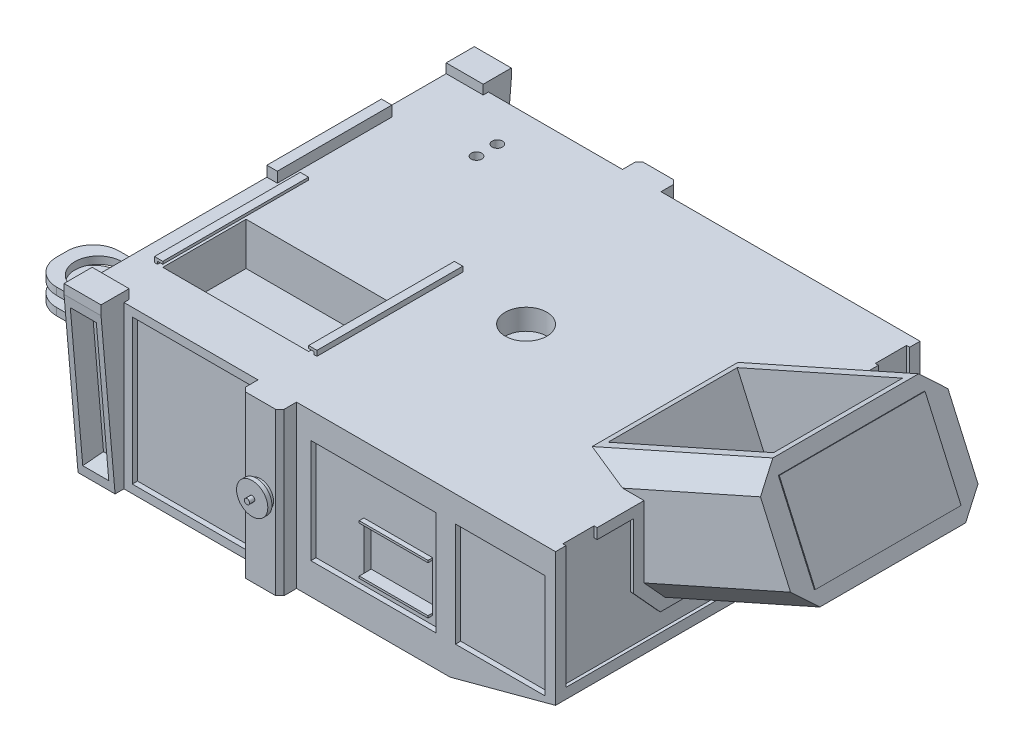
from build123d import *

# Parameters (mm, degrees)
SKETCH1_W                = 450
SKETCH1_H                = 155
BOSS_EXTRUDE1_DEPTH      = 175
BOSS_EXTRUDE2_START      = -5
SKETCH2_W                = 35.55
SKETCH2_H                = 164
BOSS_EXTRUDE2_DEPTH      = 27
SKETCH2_3_W              = 37
SKETCH2_3_H              = 155
BOSS_EXTRUDE3_DEPTH      = 16
CUT_EXTRUDE1_DEPTH       = 425.979117134
CUT_EXTRUDE1_DEPTH_BACK  = 425.979117134
CUT_EXTRUDE3_REACH       = 500.79
CHAMFER1_SIZE            = 4
SKETCH6_W                = 35.55
SKETCH6_H                = 155
BOSS_EXTRUDE4_DEPTH      = 16
SKETCH8_R                = 12.5
BOSS_EXTRUDE5_DEPTH      = 4
SKETCH9_R                = 15
BOSS_EXTRUDE6_DEPTH      = 4
SKETCH10_R               = 2.5
BOSS_EXTRUDE7_DEPTH      = 5
SKETCH11_W               = 120
SKETCH11_H               = 100
SKETCH11_W_2             = 86
SKETCH11_W_3             = 112.725
SKETCH11_H_2             = 139
CUT_EXTRUDE4_DEPTH       = 5
SKETCH12_W               = 66
SKETCH12_H               = 44
CUT_EXTRUDE5_DEPTH       = 7
SKETCH13_W               = 66
SKETCH13_H               = 2
BOSS_EXTRUDE8_DEPTH      = 4.5
SKETCH14_W               = 25
SKETCH14_H               = 138
CUT_EXTRUDE6_DEPTH       = 20
CHAMFER1_OF_MIRROR1_SIZE = 4
SKETCH15_W               = 105
SKETCH15_H               = 120
CUT_EXTRUDE7_DEPTH       = 15
SKETCH16_R               = 7.5
BOSS_EXTRUDE9_DEPTH      = 15
SKETCH17_R               = 48.5
BOSS_EXTRUDE10_DEPTH     = 10
SKETCH18_R               = 35
BOSS_EXTRUDE11_DEPTH     = 5
SKETCH19_W               = 60
SKETCH19_H               = 7
BOSS_EXTRUDE12_DEPTH     = 85
FILLET1_R                = 25
SKETCH20_R               = 22.5
CUT_EXTRUDE8_DEPTH       = 395.019352317
SKETCH21_W               = 10
SKETCH21_H               = 110
BOSS_EXTRUDE13_DEPTH     = 10
SKETCH22_W               = 90
SKETCH22_H               = 5
CUT_EXTRUDE9_DEPTH       = 2
SKETCH23_W               = 95
SKETCH23_H               = 32
CUT_EXTRUDE10_DEPTH      = 5
SKETCH24_R               = 20
CUT_EXTRUDE11_DEPTH      = 20
BOSS_EXTRUDE14_DEPTH     = 90
CHAMFER2_SIZE            = 20
SHELL3_START             = -220
SHELL3_DEPTH             = 25.55
SKETCH27_W               = 173.909634345
SKETCH27_H               = 124
CUT_EXTRUDE12_DEPTH      = 111
SKETCH32_W               = 140
SKETCH32_H               = 85
BOSS_EXTRUDE17_DEPTH     = 1
CUT_EXTRUDE15_DEPTH      = 3
SKETCH39_R               = 35
BOSS_EXTRUDE21_DEPTH     = 10
SKETCH41_R               = 5
CUT_EXTRUDE16_DEPTH      = 2
BOSS_EXTRUDE25_DEPTH     = 21
SKETCH58_R               = 11
SKETCH58_R_2             = 7.5
BOSS_EXTRUDE34_DEPTH     = 2
LPATTERN1_COUNT          = 4
LPATTERN1_PITCH          = 25
SKETCH59_R               = 35
BOSS_EXTRUDE35_DEPTH     = 3
SKETCH61_R               = 30
BOSS_EXTRUDE36_DEPTH     = 4
BOSS_EXTRUDE37_DEPTH     = 15
BOSS_EXTRUDE37_2_DEPTH   = 15
CUT_EXTRUDE19_START      = 64.5
CUT_EXTRUDE19_OUTLINE_R  = 11.5
CUT_EXTRUDE19_DEPTH      = 20
CHAMFER6_SIZE            = 10
CHAMFER7_SIZE            = 10
SKETCH63_R               = 4
CUT_EXTRUDE20_DEPTH      = 2
SKETCH64_R               = 4
CUT_EXTRUDE21_DEPTH      = 2
SKETCH65_R               = 40
BOSS_EXTRUDE38_DEPTH     = 4
SKETCH66_R               = 37.5
BOSS_EXTRUDE39_DEPTH     = 3
SKETCH67_R               = 25
CUT_EXTRUDE22_DEPTH      = 15
SKETCH68_W               = 20
SKETCH68_H               = 20
BOSS_EXTRUDE40_DEPTH     = 15
SKETCH69_R               = 5
CUT_EXTRUDE23_DEPTH      = 10
CUT_EXTRUDE25_DEPTH      = 68
SKETCH71_R               = 5
CUT_EXTRUDE26_DEPTH      = 7
SKETCH72_W               = 140.04861587
SKETCH72_H               = 79.982086861
CUT_EXTRUDE27_DEPTH      = 41
SKETCH73_R               = 11.5
BOSS_EXTRUDE42_DEPTH     = 13
SKETCH74_W               = 3
SKETCH74_H               = 140
BOSS_EXTRUDE43_DEPTH     = 5
SKETCH75_W               = 140
SKETCH75_H               = 2.5
BOSS_EXTRUDE44_DEPTH     = 5
SKETCH76_W               = 140
SKETCH76_H               = 2.5
BOSS_EXTRUDE45_DEPTH     = 5


# Read off the part's stored shape, not the designer's step: Shell3, Cut-Extrude19
with BuildPart() as part:
    # Sketch1 → Boss-Extrude1 (new, symmetric)
    with BuildSketch(Plane.XY):
        Rectangle(SKETCH1_W, SKETCH1_H)
    extrude(amount=BOSS_EXTRUDE1_DEPTH, both=True)

    # Sketch2 → Boss-Extrude2 (add)
    with BuildSketch(Plane.XY.offset(175).offset(BOSS_EXTRUDE2_START)):
        with Locations((-207.225, 4.5)):
            Rectangle(SKETCH2_W, SKETCH2_H)
    boss_extrude2 = extrude(amount=BOSS_EXTRUDE2_DEPTH)

    # Sketch2<3> → Boss-Extrude3 (add)
    with BuildSketch(Plane.XY.offset(175)):
        with Locations((-42.225, 0)):
            Rectangle(SKETCH2_3_W, SKETCH2_3_H)
    boss_extrude3 = extrude(amount=BOSS_EXTRUDE3_DEPTH)

    # Sketch2<4> → Cut-Extrude1 (cut, two sides: drawn at the far end of the back side and taken through both)
    with BuildSketch(Plane.XY.offset(175).offset(-CUT_EXTRUDE1_DEPTH_BACK)):
        Polygon((123.658328291, -77.5), (225, -50.345580906), (225, -77.5), align=None)
    extrude(amount=CUT_EXTRUDE1_DEPTH + CUT_EXTRUDE1_DEPTH_BACK, mode=Mode.SUBTRACT)

    # Sketch4 → Cut-Extrude3 (cut, up to next)
    with BuildSketch(Plane.ZY.offset(225), mode=Mode.PRIVATE) as cut_extrude3_sk1:
        Polygon((197, 77.5), (197, -77.5), (183.5, -77.5), align=None)
    cut_extrude3_tool1 = extrude(cut_extrude3_sk1.sketch, amount=-CUT_EXTRUDE3_REACH, mode=Mode.PRIVATE) & part.part
    cut_extrude3 = cut_extrude3_tool1.solids().sort_by_distance((-225, -25.833333, 192.5))[0]
    add(cut_extrude3, mode=Mode.SUBTRACT)

    # Chamfer1
    chamfer1_edges = [part.edges().sort_by_distance(p)[0] for p in [
        (-23.725, 0, 191),
        (-60.725, 0, 191),
    ]]
    chamfer(chamfer1_edges, length=CHAMFER1_SIZE)

    # Sketch6 → Boss-Extrude4 (add)
    with BuildSketch(Plane.XY.offset(175)):
        with Locations((-207.225, 0)):
            Rectangle(SKETCH6_W, SKETCH6_H)
    extrude(amount=-BOSS_EXTRUDE4_DEPTH)

    # Sketch8 → Boss-Extrude5 (add)
    with BuildSketch(Plane.XY.offset(191)):
        with Locations(Location((-42.314976126, 0, 0), (0, 0, 180))):
            Circle(SKETCH8_R)
    boss_extrude5 = extrude(amount=BOSS_EXTRUDE5_DEPTH)

    # Sketch9 → Boss-Extrude6 (add)
    with BuildSketch(Plane.XY.offset(195)):
        with Locations((-42.314976126, 0)):
            Circle(SKETCH9_R)
    boss_extrude6 = extrude(amount=BOSS_EXTRUDE6_DEPTH)

    # Sketch10 → Boss-Extrude7 (add)
    with BuildSketch(Plane.XY.offset(199)):
        with Locations((-42.314976126, 0)):
            Circle(SKETCH10_R)
    boss_extrude7 = extrude(amount=BOSS_EXTRUDE7_DEPTH)

    # Sketch11 → Cut-Extrude4 (cut)
    with BuildSketch(Plane.XY.offset(175)):
        with Locations((50, 2.5)):
            Rectangle(SKETCH11_W, SKETCH11_H)
        with Locations((171.861480719, 2.5)):
            Rectangle(SKETCH11_W_2, SKETCH11_H)
        with Locations((-125.0875, 0)):
            Rectangle(SKETCH11_W_3, SKETCH11_H_2)
    cut_extrude4 = extrude(amount=-CUT_EXTRUDE4_DEPTH, mode=Mode.SUBTRACT)

    # Sketch12 → Cut-Extrude5 (cut)
    with BuildSketch(Plane.XY.offset(170)):
        with Locations((69, -15.5)):
            Rectangle(SKETCH12_W, SKETCH12_H)
    cut_extrude5 = extrude(amount=-CUT_EXTRUDE5_DEPTH, mode=Mode.SUBTRACT)

    # Sketch13 → Boss-Extrude8 (add)
    with BuildSketch(Plane.XY.offset(170)):
        with Locations((69, 7.5)):
            Rectangle(SKETCH13_W, SKETCH13_H)
        with Locations((69, -38.5)):
            Rectangle(SKETCH13_W, SKETCH13_H)
    boss_extrude8 = extrude(amount=BOSS_EXTRUDE8_DEPTH)

    # Sketch14 → Cut-Extrude6 (cut)
    with BuildSketch(Plane(origin=(0, -16.445408917, 188.817657933), x_dir=(1, 0, 0), z_dir=(0, -0.08676829043906238, 0.9962285198559027))):
        with Locations((-207.225, 16.507667256)):
            Rectangle(SKETCH14_W, SKETCH14_H)
    cut_extrude6 = extrude(amount=-CUT_EXTRUDE6_DEPTH, mode=Mode.SUBTRACT)

    # Mirror1: Boss-Extrude2, Boss-Extrude3, Cut-Extrude3, Boss-Extrude5, Boss-Extrude6, Boss-Extrude7, Cut-Extrude4, Cut-Extrude5, Boss-Extrude8, Cut-Extrude6 across plane
    add(boss_extrude2.mirror(Plane.XY))
    add(boss_extrude3.mirror(Plane.XY))
    add(cut_extrude3.mirror(Plane.XY), mode=Mode.SUBTRACT)
    add(boss_extrude5.mirror(Plane.XY))
    add(boss_extrude6.mirror(Plane.XY))
    add(boss_extrude7.mirror(Plane.XY))
    add(cut_extrude4.mirror(Plane.XY), mode=Mode.SUBTRACT)
    add(cut_extrude5.mirror(Plane.XY), mode=Mode.SUBTRACT)
    add(boss_extrude8.mirror(Plane.XY))
    add(cut_extrude6.mirror(Plane.XY), mode=Mode.SUBTRACT)

    # Chamfer1 of Mirror1
    chamfer1_of_mirror1_edges = [part.edges().sort_by_distance(p)[0] for p in [
        (-23.725, 0, -191),
        (-60.725, 0, -191),
    ]]
    chamfer(chamfer1_of_mirror1_edges, length=CHAMFER1_OF_MIRROR1_SIZE)

    # Sketch15 → Cut-Extrude7 (cut)
    with BuildSketch(Plane.ZY.offset(225)):
        with Locations((-116.586660436, 0)):
            Rectangle(SKETCH15_W, SKETCH15_H)
    extrude(amount=-CUT_EXTRUDE7_DEPTH, mode=Mode.SUBTRACT)

    # Sketch16 → Boss-Extrude9 (add)
    with BuildSketch(Plane.ZY.offset(210)):
        with Locations((-142.086660436, -5)):
            Circle(SKETCH16_R)
    extrude(amount=BOSS_EXTRUDE9_DEPTH)

    # Sketch17 → Boss-Extrude10 (add)
    with BuildSketch(Plane.ZY.offset(225)):
        with Locations(Location((99, 0, 0), (0, 0, 90))):
            Circle(SKETCH17_R)
    extrude(amount=BOSS_EXTRUDE10_DEPTH)

    # Sketch18 → Boss-Extrude11 (add)
    with BuildSketch(Plane.ZY.offset(235)):
        with Locations(Location((99, 0, 0), (0, 0, 270))):
            Circle(SKETCH18_R)
    extrude(amount=BOSS_EXTRUDE11_DEPTH)

    # Sketch19 → Boss-Extrude12 (add)
    with BuildSketch(Plane.ZY.offset(240)):
        with Locations((99, 8.5)):
            Rectangle(SKETCH19_W, SKETCH19_H)
        with Locations((99, -8.5)):
            Rectangle(SKETCH19_W, SKETCH19_H)
    extrude(amount=BOSS_EXTRUDE12_DEPTH)

    # Fillet1
    fillet1_edges = [part.edges().sort_by_distance(p)[0] for p in [
        (-325, 8.5, 129),
        (-325, 8.5, 69),
        (-325, -8.5, 69),
        (-325, -8.5, 129),
    ]]
    fillet(fillet1_edges, radius=FILLET1_R)

    # Sketch20 → Cut-Extrude8 (cut, through all)
    with BuildSketch(Plane(origin=(0, 12, 0), x_dir=(1, 0, 0), z_dir=(0, 1, 0))):
        with Locations(Location((-290, -99, 0), (0, 0, 180))):
            Circle(SKETCH20_R)
    extrude(amount=-CUT_EXTRUDE8_DEPTH, mode=Mode.SUBTRACT)

    # Sketch21 → Boss-Extrude13 (add)
    with BuildSketch(Plane(origin=(0, 77.5, 0), x_dir=(1, 0, 0), z_dir=(0, 1, 0))):
        with Locations((-220, 52.801598025)):
            Rectangle(SKETCH21_W, SKETCH21_H)
    extrude(amount=BOSS_EXTRUDE13_DEPTH)

    # Sketch22 → Cut-Extrude9 (cut)
    with BuildSketch(Plane.ZY.offset(225)):
        with Locations((-52.801598025, 82.5)):
            Rectangle(SKETCH22_W, SKETCH22_H)
    extrude(amount=-CUT_EXTRUDE9_DEPTH, mode=Mode.SUBTRACT)

    # Sketch23 → Cut-Extrude10 (cut)
    with BuildSketch(Plane.ZY.offset(225)):
        with Locations((0.217566053, -15.096750984)):
            Rectangle(SKETCH23_W, SKETCH23_H)
    extrude(amount=-CUT_EXTRUDE10_DEPTH, mode=Mode.SUBTRACT)

    # Sketch24 → Cut-Extrude11 (cut)
    with BuildSketch(Plane(origin=(0, 77.5, 0), x_dir=(1, 0, 0), z_dir=(0, 1, 0))):
        with Locations(Location((21.685023874, 0, 0), (0, 0, 270))):
            Circle(SKETCH24_R)
    extrude(amount=-CUT_EXTRUDE11_DEPTH, mode=Mode.SUBTRACT)

    # Sketch26 → Boss-Extrude14 (add, symmetric)
    with BuildSketch(Plane.XY):
        Polygon((99, 52.5), (328.642003165, 154.743207161), (373.789770547, 53.339661363), (144.147767381, -48.903545798), align=None)
    extrude(amount=BOSS_EXTRUDE14_DEPTH, both=True)

    # Chamfer2
    chamfer2_edges = [part.edges().sort_by_distance(p)[0] for p in [
        (241.896461257, 116.12160358, -90),
        (299.394885273, 20.216924399, -90),
        (241.896461257, 116.12160358, 90),
        (299.394885273, 20.216924399, 90),
    ]]
    chamfer(chamfer2_edges, length=CHAMFER2_SIZE)

    # Shell3 outline → Shell3 (cut)
    with BuildSketch(Plane.YZ.offset(SHELL3_START)):
        Polygon((81.5, -175), (75.608371903, -175), (74.154751922, -191.689710893), (77.717330555, -192), (81.5, -192), align=None)
        Polygon((75.608371903, 175), (81.5, 175), (81.5, 192), (77.717330555, 192), (74.154751922, 191.689710893), align=None)
    extrude(amount=SHELL3_DEPTH, mode=Mode.SUBTRACT)

    # Sketch27 → Cut-Extrude12 (cut)
    with BuildSketch(Plane(origin=(-3.129516684, 7.029009556, 0), x_dir=(0.9135454576426033, 0.4067366430757949, 0), z_dir=(-0.4067366430757949, 0.9135454576426033, 0))):
        with Locations((268.21432463, 0)):
            Rectangle(SKETCH27_W, SKETCH27_H)
    extrude(amount=-CUT_EXTRUDE12_DEPTH, mode=Mode.SUBTRACT)

    # Sketch32 → Boss-Extrude17 (add)
    with BuildSketch(Plane(origin=(331.771519849, 147.714197605, 0), x_dir=(0, 0, -1), z_dir=(0.9135454576426031, 0.4067366430757953, 0))):
        with Locations((0, -47.805791138)):
            Rectangle(SKETCH32_W, SKETCH32_H)
    extrude(amount=BOSS_EXTRUDE17_DEPTH)

    # Sketch38 → Cut-Extrude15 (cut)
    with BuildSketch(Plane(origin=(225, 0, 0), x_dir=(0, 0, -1), z_dir=(1, 0, 0))):
        Polygon((62, -22.905812565), (16, -22.905812565), (16, -28.378993958), (-16, -28.378993958), (-16, -22.905812565), (-62, -22.905812565), (-74.409158017, -22.905812565), (-100, 5.106851466), (-100, 67.5), (-135, 67.5), (-135, 117.5), (-165, 117.5), (-165, -40.345580906), (165, -40.345580906), (165, 117.5), (135, 117.5), (135, 67.5), (100, 67.5), (100, 5.106851466), (74.409158017, -22.905812565), align=None)
    extrude(amount=-CUT_EXTRUDE15_DEPTH, mode=Mode.SUBTRACT)

    # Sketch39 → Boss-Extrude21 (add)
    with BuildSketch(Plane(origin=(0, 77.5, 0), x_dir=(1, 0, 0), z_dir=(0, 1, 0))):
        with Locations(Location((-175, 131, 0), (0, 0, 90))):
            Circle(SKETCH39_R)
    extrude(amount=BOSS_EXTRUDE21_DEPTH)

    # Sketch41 → Cut-Extrude16 (cut)
    with BuildSketch(Plane(origin=(0, 87.5, 0), x_dir=(1, 0, 0), z_dir=(0, 1, 0))):
        with Locations(Location((-181.427876097, 123.339555569, 0), (0, 0, 270))):
            Circle(SKETCH41_R)
        with Locations(Location((-168.572123903, 138.660444431, 0), (0, 0, 90))):
            Circle(SKETCH41_R)
    extrude(amount=-CUT_EXTRUDE16_DEPTH, mode=Mode.SUBTRACT)

    # Sketch46 → Boss-Extrude25 (add)
    with BuildSketch(Plane(origin=(0, 77.5, 0), x_dir=(1, 0, 0), z_dir=(0, 1, 0))):
        with BuildLine():
            Line((103.0389808, 78.083012163), (88.150919348, 78.083012163))
            Line((88.150919348, 78.083012163), (88.150919348, -51.916987837))
            Line((88.150919348, -51.916987837), (150.150919348, -51.916987837))
            Line((150.150919348, -51.916987837), (150.150919348, 13.083012163))
            ThreePointArc((150.150919348, 13.083012163), (119.660314516, 20.303921956), (103.0389808, 46.866109116))
            Line((103.0389808, 46.866109116), (103.0389808, 78.083012163))
        make_face()
    extrude(amount=BOSS_EXTRUDE25_DEPTH)

    # Sketch58 → Boss-Extrude34 (add)
    with BuildSketch(Plane(origin=(0, 77.5, 0), x_dir=(1, 0, 0), z_dir=(0, 1, 0))):
        with Locations(Location((-209, -22.123525633, 0), (0, 0, 90))):
            Circle(SKETCH58_R)
        with Locations(Location((-209, -22.123525633, 0), (0, 0, 270))):
            Circle(SKETCH58_R_2, mode=Mode.SUBTRACT)
    boss_extrude34 = extrude(amount=BOSS_EXTRUDE34_DEPTH)

    # LPattern1: Boss-Extrude34 ×4
    with Locations(*[(0, 0, i * LPATTERN1_PITCH) for i in range(1, LPATTERN1_COUNT)]):
        add(boss_extrude34)

    # Sketch59 → Boss-Extrude35 (add)
    with BuildSketch(Plane(origin=(0, 77.5, 0), x_dir=(1, 0, 0), z_dir=(0, 1, 0))):
        with Locations(Location((-139, 50, 0), (0, 0, 90))):
            Circle(SKETCH59_R)
    extrude(amount=BOSS_EXTRUDE35_DEPTH)

    # Sketch61 → Boss-Extrude36 (add)
    with BuildSketch(Plane(origin=(0, 80.5, 0), x_dir=(1, 0, 0), z_dir=(0, 1, 0))):
        with Locations(Location((-139, 50, 0), (0, 0, 270))):
            Circle(SKETCH61_R)
    extrude(amount=BOSS_EXTRUDE36_DEPTH)

    # Cut-Extrude19 outline → Cut-Extrude19 (cut)
    with BuildSketch(Plane(origin=(0, 0, 0), x_dir=(1, 0, 0), z_dir=(0, 1, 0)).offset(CUT_EXTRUDE19_START)):
        with Locations((-145.333526909, 36.402704795)):
            Circle(CUT_EXTRUDE19_OUTLINE_R)
        with Locations((-132.666473091, 63.597295205)):
            Circle(CUT_EXTRUDE19_OUTLINE_R)
    extrude(amount=CUT_EXTRUDE19_DEPTH, mode=Mode.SUBTRACT)

    # Sketch65 → Boss-Extrude38 (add)
    with BuildSketch(Plane(origin=(0, 77.5, 0), x_dir=(1, 0, 0), z_dir=(0, 1, 0))):
        with Locations(Location((-130, -87.127951309, 0), (0, 0, 90))):
            Circle(SKETCH65_R)
    extrude(amount=BOSS_EXTRUDE38_DEPTH)

    # Sketch66 → Boss-Extrude39 (add)
    with BuildSketch(Plane(origin=(0, 81.5, 0), x_dir=(1, 0, 0), z_dir=(0, 1, 0))):
        with Locations(Location((-130, -87.127951309, 0), (0, 0, 270))):
            Circle(SKETCH66_R)
    extrude(amount=BOSS_EXTRUDE39_DEPTH)

    # Sketch67 → Cut-Extrude22 (cut)
    with BuildSketch(Plane(origin=(0, 84.5, 0), x_dir=(1, 0, 0), z_dir=(0, 1, 0))):
        with Locations(Location((-130, -87.127951309, 0), (0, 0, 270))):
            Circle(SKETCH67_R)
    extrude(amount=-CUT_EXTRUDE22_DEPTH, mode=Mode.SUBTRACT)

    # Sketch68 → Boss-Extrude40 (add)
    with BuildSketch(Plane(origin=(0, 77.5, 0), x_dir=(1, 0, 0), z_dir=(0, 1, 0))):
        with Locations((-50, -137.127951309)):
            Rectangle(SKETCH68_W, SKETCH68_H)
    extrude(amount=BOSS_EXTRUDE40_DEPTH)

    # Sketch69 → Cut-Extrude23 (cut)
    with BuildSketch(Plane(origin=(0, 0, 127.127951309), x_dir=(-1, 0, 0), z_dir=(0, 0, -1))):
        with Locations((50, 85)):
            Circle(SKETCH69_R)
    extrude(amount=-CUT_EXTRUDE23_DEPTH, mode=Mode.SUBTRACT)


with BuildPart() as body_2:
    # Sketch62 → Boss-Extrude37 (new body)
    with BuildSketch(Plane(origin=(0, 84.5, 0), x_dir=(1, 0, 0), z_dir=(0, 1, 0))):
        Polygon((-87.067707838, 80.968323022), (-105.197434778, 89.413025568), (-96.752732232, 107.542752508), (-78.623005292, 99.098049962), align=None)
    extrude(amount=BOSS_EXTRUDE37_DEPTH)

    # Chamfer6
    chamfer6_edges = [body_2.edges().sort_by_distance(p)[0] for p in [
        (-82.845356565, 99.5, -90.033186492),
    ]]
    chamfer(chamfer6_edges, length=CHAMFER6_SIZE)

    # Sketch63 → Cut-Extrude20 (cut)
    with BuildSketch(Plane(origin=(-120.66544217, 0, -56.20513591), x_dir=(-0.42223512728575724, 0, 0.9064863469936988), z_dir=(-0.9064863469936989, 0, -0.4222351272857573))):
        with Locations((-46.633634657, 91.5)):
            Circle(SKETCH63_R)
    extrude(amount=-CUT_EXTRUDE20_DEPTH, mode=Mode.SUBTRACT)


with BuildPart() as body_3:
    # Sketch62 → Boss-Extrude37 2 (new body)
    with BuildSketch(Plane(origin=(0, 84.5, 0), x_dir=(1, 0, 0), z_dir=(0, 1, 0))):
        Polygon((-93.353724669, 1.159263433), (-101.798427214, -16.970463506), (-83.668700274, -25.415166052), (-75.223997729, -7.285439112), align=None)
    extrude(amount=BOSS_EXTRUDE37_2_DEPTH)

    # Chamfer7
    chamfer7_edges = [body_3.edges().sort_by_distance(p)[0] for p in [
        (-92.733563744, 99.5, 21.192814779),
    ]]
    chamfer(chamfer7_edges, length=CHAMFER7_SIZE)

    # Sketch64 → Cut-Extrude21 (cut)
    with BuildSketch(Plane(origin=(-16.199627154, 0, 34.778586367), x_dir=(-0.9064863469936988, 0, -0.42223512728575724), z_dir=(0.4222351272857573, 0, -0.9064863469936989))):
        with Locations((75.113358596, 91.5)):
            Circle(SKETCH64_R)
    extrude(amount=-CUT_EXTRUDE21_DEPTH, mode=Mode.SUBTRACT)


with BuildPart() as cut_extrude25_tool:
    # Sketch70 → Cut-Extrude25 (new body)
    with BuildSketch(Plane(origin=(0, 77.5, 0), x_dir=(1, 0, 0), z_dir=(0, 1, 0))):
        Polygon((225, 135), (222, 135), (222, 165), (225, 165), (225, 175), (-23.725, 175), (-23.725, 187), (-27.725, 191), (-56.725, 191), (-60.725, 187), (-60.725, 175), (-189.45, 175), (-189.45, 170), (-225, 170), (-225, 107.801598025), (-215, 107.801598025), (-215, -2.198401975), (-225, -2.198401975), (-225, -170), (-189.45, -170), (-189.45, -175), (-60.725, -175), (-60.725, -187), (-56.725, -191), (-27.725, -191), (-23.725, -187), (-23.725, -175), (225, -175), (225, -165), (222, -165), (222, -135), (225, -135), (225, -90), (204.322786059, -90), (155.150919348, -70), (155.150919348, 70), (204.322786059, 90), (225, 90), align=None)
    extrude(amount=CUT_EXTRUDE25_DEPTH)


with BuildPart() as part_1:
    add(part.part)

    # Cut-Extrude25: cut by cut_extrude25_tool
    add(cut_extrude25_tool.part, mode=Mode.SUBTRACT)

    # Sketch71 → Cut-Extrude26 (cut)
    with BuildSketch(Plane(origin=(0, 77.5, 0), x_dir=(1, 0, 0), z_dir=(0, 1, 0))):
        with Locations(Location((-141.879862218, 115.984976205, 0), (0, 0, 270))):
            Circle(SKETCH71_R)
        with Locations(Location((-141.879862218, 135.984976205, 0), (0, 0, 270))):
            Circle(SKETCH71_R)
    extrude(amount=-CUT_EXTRUDE26_DEPTH, mode=Mode.SUBTRACT)

    # Sketch72 → Cut-Extrude27 (cut)
    with BuildSketch(Plane(origin=(0, 77.5, 0), x_dir=(1, 0, 0), z_dir=(0, 1, 0))):
        with Locations((-130, -87.12795131)):
            Rectangle(SKETCH72_W, SKETCH72_H)
    extrude(amount=-CUT_EXTRUDE27_DEPTH, mode=Mode.SUBTRACT)

    # Sketch73 → Boss-Extrude42 (add)
    with BuildSketch(Plane(origin=(0, 64.5, 0), x_dir=(1, 0, 0), z_dir=(0, 1, 0))):
        with Locations((-132.666473091, 63.597295205)):
            Circle(SKETCH73_R)
        with Locations((-145.333526909, 36.402704795)):
            Circle(SKETCH73_R)
    extrude(amount=BOSS_EXTRUDE42_DEPTH)

    # Sketch74 → Boss-Extrude43 (add)
    with BuildSketch(Plane(origin=(0, 77.5, 0), x_dir=(1, 0, 0), z_dir=(0, 1, 0))):
        with Locations((-206.524307935, -57.11899474)):
            Rectangle(SKETCH74_W, SKETCH74_H)
        with Locations((-53.475692065, -57.11899474)):
            Rectangle(SKETCH74_W, SKETCH74_H)
    extrude(amount=BOSS_EXTRUDE43_DEPTH)

    # Sketch75 → Boss-Extrude44 (add)
    with BuildSketch(Plane.ZY.offset(54.975692065)):
        with Locations((57.11899474, 81.25)):
            Rectangle(SKETCH75_W, SKETCH75_H)
    extrude(amount=BOSS_EXTRUDE44_DEPTH)

    # Sketch76 → Boss-Extrude45 (add)
    with BuildSketch(Plane(origin=(-205.024307935, 0, 0), x_dir=(0, 0, -1), z_dir=(1, 0, 0))):
        with Locations((-57.11899474, 81.25)):
            Rectangle(SKETCH76_W, SKETCH76_H)
    extrude(amount=BOSS_EXTRUDE45_DEPTH)


with BuildPart() as body_2_1:
    add(body_2.part)

    # Cut-Extrude25: cut by cut_extrude25_tool
    add(cut_extrude25_tool.part, mode=Mode.SUBTRACT)


with BuildPart() as body_3_1:
    add(body_3.part)

    # Cut-Extrude25: cut by cut_extrude25_tool
    add(cut_extrude25_tool.part, mode=Mode.SUBTRACT)


solid = part_1.part
